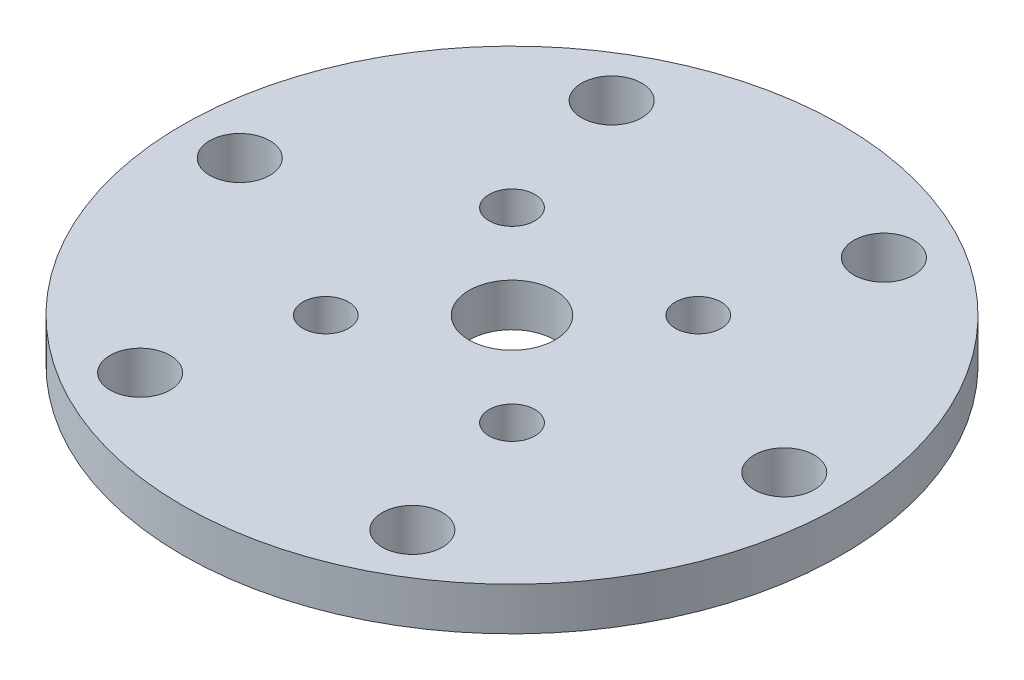
from build123d import *

# Parameters (mm, degrees)
SKETCH_1_R          = 23
SKETCH_1_R_2        = 2.1
EXTRUDE_1_DEPTH     = 3
SKETCH_2_R          = 1.6
SKETCH_2_R_2        = 3
CUT_EXTRUDE_1_DEPTH = 33.664965942


with BuildPart() as part:
    # 草图1 → 凸台-拉伸1 (new body)
    with BuildSketch(Plane(origin=(0, 0, 0), x_dir=(1, 0, 0), z_dir=(0, 1, 0))):
        Circle(SKETCH_1_R)
        with Locations((19, 0)):
            Circle(SKETCH_1_R_2, mode=Mode.SUBTRACT)
        with Locations((9.5, -16.454482672)):
            Circle(SKETCH_1_R_2, mode=Mode.SUBTRACT)
        with Locations((-9.5, -16.454482672)):
            Circle(SKETCH_1_R_2, mode=Mode.SUBTRACT)
        with Locations((-19, 0)):
            Circle(SKETCH_1_R_2, mode=Mode.SUBTRACT)
        with Locations((-9.5, 16.454482672)):
            Circle(SKETCH_1_R_2, mode=Mode.SUBTRACT)
        with Locations((9.5, 16.454482672)):
            Circle(SKETCH_1_R_2, mode=Mode.SUBTRACT)
    extrude(amount=EXTRUDE_1_DEPTH)

    # 草图2 → 切除-拉伸1 (cut, through all)
    with BuildSketch(Plane(origin=(0, 3, 0), x_dir=(1, 0, 0), z_dir=(0, 1, 0))):
        with Locations((6.5, 6.5)):
            Circle(SKETCH_2_R)
        with Locations((6.5, -6.5)):
            Circle(SKETCH_2_R)
        with Locations((-6.5, -6.5)):
            Circle(SKETCH_2_R)
        with Locations((-6.5, 6.5)):
            Circle(SKETCH_2_R)
        Circle(SKETCH_2_R_2)
    extrude(amount=-CUT_EXTRUDE_1_DEPTH, mode=Mode.SUBTRACT)


solid = part.part
